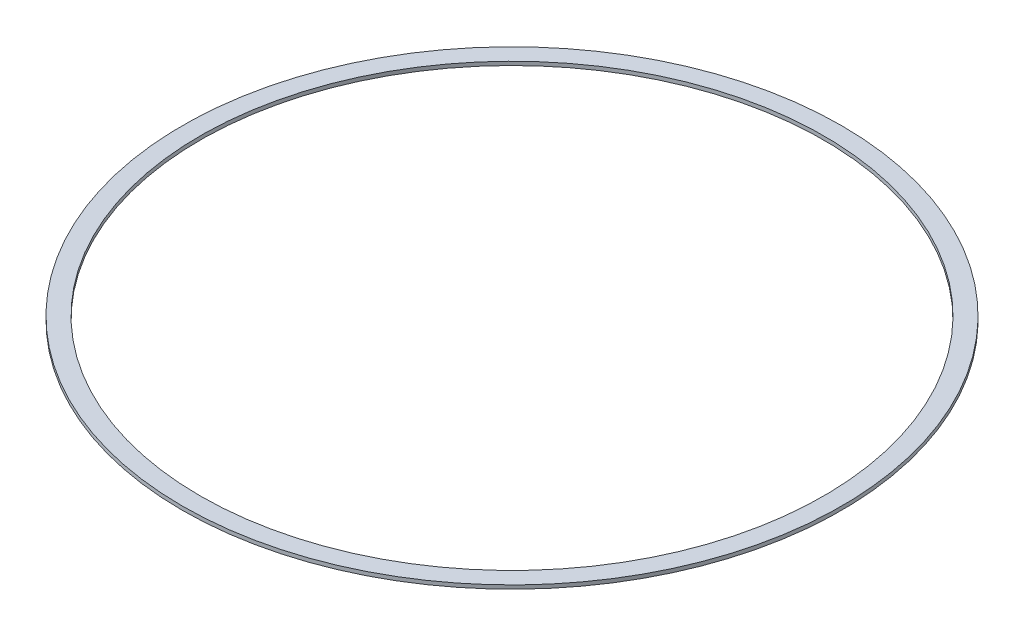
from build123d import *

# Parameters (mm, degrees)
SKETCH1_R           = 224.9678
SKETCH1_R_2         = 212.8774
BOSS_EXTRUDE1_DEPTH = 2.54


with BuildPart() as part:
    # Sketch1 → Boss-Extrude1 (new body)
    with BuildSketch(Plane(origin=(0, 0, 0), x_dir=(1, 0, 0), z_dir=(0, 1, 0))):
        Circle(SKETCH1_R)
        Circle(SKETCH1_R_2, mode=Mode.SUBTRACT)
    extrude(amount=BOSS_EXTRUDE1_DEPTH)


solid = part.part
